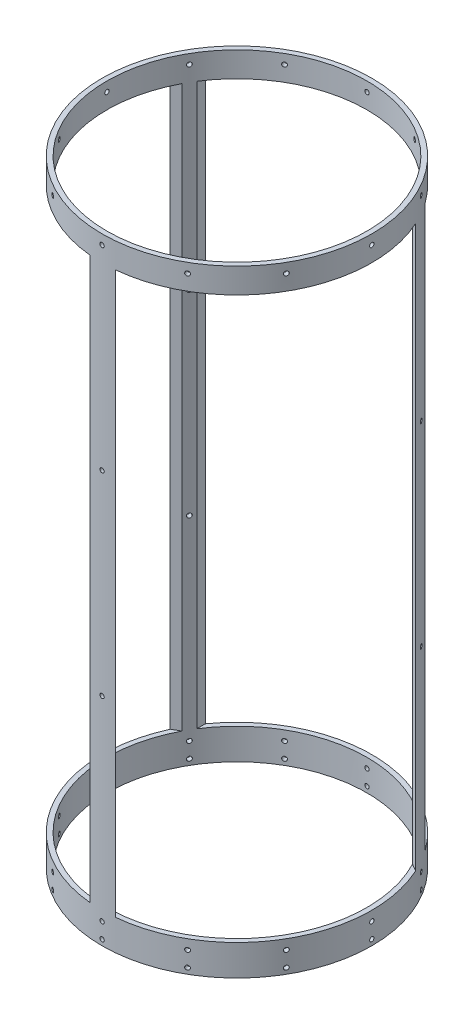
from build123d import *

# Parameters (mm, degrees)
SKETCH1_R               = 88.9
SKETCH1_R_2             = 85.725
BOSS_EXTRUDE1_DEPTH     = 203.2
CUT_EXTRUDE1_REACH      = 240.949
CUT_EXTRUDE1_END_RADIUS = 88.9
SKETCH2_W               = 144.78
SKETCH2_H               = 369.57
CIRPATTERN1_COUNT       = 3
SKETCH3_R               = 1.4351
CUT_EXTRUDE2_DEPTH      = 15.24
CIRPATTERN2_COUNT       = 12
SKETCH4_R               = 1.4351
CUT_EXTRUDE3_DEPTH      = 15.24
CIRPATTERN3_COUNT       = 12
SKETCH5_R               = 1.4351
CUT_EXTRUDE4_DEPTH      = 35.56
CIRPATTERN4_COUNT       = 3


with BuildPart() as part:
    # Sketch1 → Boss-Extrude1 (new, symmetric)
    with BuildSketch(Plane(origin=(0, 0, 0), x_dir=(1, 0, 0), z_dir=(0, 1, 0))):
        Circle(SKETCH1_R)
        Circle(SKETCH1_R_2, mode=Mode.SUBTRACT)
    extrude(amount=BOSS_EXTRUDE1_DEPTH, both=True)

    # Cut-Extrude1: up to this cylinder (the profile starts inside it)
    cut_extrude1_end = Plane(origin=(0, 1.905, 0), z_dir=(0, -1, 0)) * Cylinder(CUT_EXTRUDE1_END_RADIUS, 660.698, mode=Mode.PRIVATE)
    # Sketch2 → Cut-Extrude1 (cut, up to the surface)
    with BuildSketch(Plane.XY, mode=Mode.PRIVATE) as cut_extrude1_sk1:
        with Locations((0, 1.905)):
            Rectangle(SKETCH2_W, SKETCH2_H)
    cut_extrude1_tool1 = extrude(cut_extrude1_sk1.sketch, amount=-CUT_EXTRUDE1_REACH, mode=Mode.PRIVATE) & cut_extrude1_end
    cut_extrude1 = cut_extrude1_tool1.solids().sort_by_distance((0, 1.905, 0))[0]
    add(cut_extrude1, mode=Mode.SUBTRACT)

    # CirPattern1: Cut-Extrude1 ×3 about axis
    cirpattern1_axis = Axis((0, 203.2, 0), (0, -1, 0))
    for i in range(1, CIRPATTERN1_COUNT):
        add(cut_extrude1.rotate(cirpattern1_axis, i * 360 / CIRPATTERN1_COUNT), mode=Mode.SUBTRACT)

    # Sketch3 → Cut-Extrude2 (cut)
    with BuildSketch(Plane(origin=(88.9, 0, 0), x_dir=(0, 0, -1), z_dir=(1, 0, 0))):
        with Locations((0, -199.39)):
            Circle(SKETCH3_R)
        with Locations((0, -189.23)):
            Circle(SKETCH3_R)
    cut_extrude2 = extrude(amount=-CUT_EXTRUDE2_DEPTH, mode=Mode.SUBTRACT)

    # CirPattern2: Cut-Extrude2 ×12 about axis
    cirpattern2_axis = Axis((0, 203.2, 0), (0, -1, 0))
    for i in range(1, CIRPATTERN2_COUNT):
        add(cut_extrude2.rotate(cirpattern2_axis, i * 360 / CIRPATTERN2_COUNT), mode=Mode.SUBTRACT)

    # Sketch4 → Cut-Extrude3 (cut)
    with BuildSketch(Plane(origin=(88.9, 0, 0), x_dir=(0, 0, -1), z_dir=(1, 0, 0))):
        with Locations((0, 196.85)):
            Circle(SKETCH4_R)
    cut_extrude3 = extrude(amount=-CUT_EXTRUDE3_DEPTH, mode=Mode.SUBTRACT)

    # CirPattern3: Cut-Extrude3 ×12 about axis
    cirpattern3_axis = Axis((0, 203.2, 0), (0, -1, 0))
    for i in range(1, CIRPATTERN3_COUNT):
        add(cut_extrude3.rotate(cirpattern3_axis, i * 360 / CIRPATTERN3_COUNT), mode=Mode.SUBTRACT)

    # Sketch5 → Cut-Extrude4 (cut)
    with BuildSketch(Plane.XY.offset(88.9)):
        with Locations((0, 68.1736)):
            Circle(SKETCH5_R)
        with Locations((0, -60.5536)):
            Circle(SKETCH5_R)
    cut_extrude4 = extrude(amount=-CUT_EXTRUDE4_DEPTH, mode=Mode.SUBTRACT)

    # CirPattern4: Cut-Extrude4 ×3 about axis
    cirpattern4_axis = Axis((0, 203.2, 0), (0, -1, 0))
    for i in range(1, CIRPATTERN4_COUNT):
        add(cut_extrude4.rotate(cirpattern4_axis, i * 360 / CIRPATTERN4_COUNT), mode=Mode.SUBTRACT)


solid = part.part
